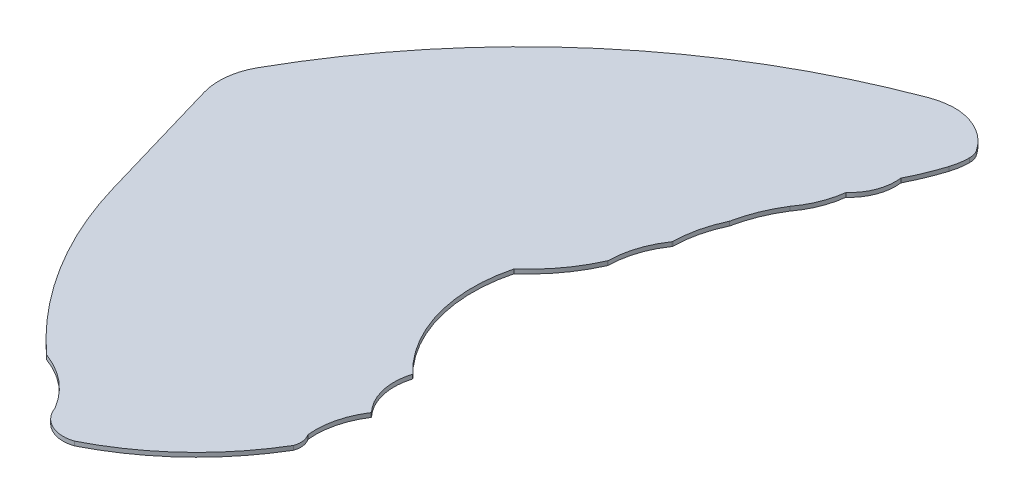
from build123d import *

# Parameters (mm, degrees)
RESSALTO_EXTRUS_O1_DEPTH = 2
RESSALTO_EXTRUS_O2_START = 2
RESSALTO_EXTRUS_O2_DEPTH = 0.2
ESBO_O3_W                = 13.5
ESBO_O3_H                = 41.75
CORTE_EXTRUS_O2_DEPTH    = 0.2


# Read off the part's stored shape, not the designer's step: Ressalto-extrusão2
with BuildPart() as part:
    # Esboço1 → Ressalto-extrusão1 (new body)
    with BuildSketch(Plane(origin=(0, 0, 0), x_dir=(1, 0, 0), z_dir=(0, 1, 0))):
        with BuildLine():
            Line((16.890636414, -92.871950666), (-2.891885916, -25.331386579))
            ThreePointArc((-2.891885916, -25.331386579), (-4.004170085, -12.373640544), (0, 0))
            ThreePointArc((0, 0), (80.341988523, 97.826401656), (189.397159866, 162.105555232))
            ThreePointArc((189.397159866, 162.105555232), (196.305976757, 163.870755082), (203.432149719, 164.126372503))
            ThreePointArc((203.432149719, 164.126372503), (216.132997815, 159.854580332), (225.805048795, 150.58035904))
            ThreePointArc((225.805048795, 150.58035904), (226.92415432, 148.202079294), (227.308114084, 145.601851107))
            ThreePointArc((227.308114084, 145.601851107), (226.936116515, 140.796582456), (225.828988219, 136.105819626))
            ThreePointArc((225.828988219, 136.105819626), (222.53357195, 127.064851642), (218.517613108, 118.320084919))
            ThreePointArc((218.517613108, 118.320084919), (217.157138995, 106.918422119), (210.665701384, 97.446883587))
            ThreePointArc((210.665701384, 97.446883587), (207.81407221, 86.384811826), (202.212176332, 76.428909901))
            ThreePointArc((202.212176332, 76.428909901), (196.683977717, 65.597702677), (193.192392505, 53.949318131))
            ThreePointArc((193.192392505, 53.949318131), (193.186037336, 53.925638832), (193.176832614, 53.902915046))
            ThreePointArc((193.176832614, 53.902915046), (189.041723719, 42.177149), (187.495240153, 29.840167866))
            ThreePointArc((187.495240153, 29.840167866), (187.463240561, 29.647364474), (187.376766076, 29.472095295))
            ThreePointArc((187.376766076, 29.472095295), (181.421355488, 17.384501121), (179.237322945, 4.087627428))
            ThreePointArc((179.237322945, 4.087627428), (179.232638679, 4.047550287), (179.220005433, 4.009229005))
            ThreePointArc((179.220005433, 4.009229005), (170.345122282, -11.218617872), (158.407910237, -24.186032419))
            ThreePointArc((158.407910237, -24.186032419), (158.838253644, -64.171647637), (179.513294894, -98.399958861))
            ThreePointArc((179.513294894, -98.399958861), (179.568845143, -98.494180052), (179.566523634, -98.60353303))
            ThreePointArc((179.566523634, -98.60353303), (179.033051629, -113.383903181), (185.969624565, -126.446364285))
            ThreePointArc((185.969624565, -126.446364285), (186.089619632, -126.716123165), (186.018022228, -127.002553753))
            ThreePointArc((186.018022228, -127.002553753), (180.544757753, -139.671656891), (179.579203123, -153.438664648))
            ThreePointArc((179.579203123, -153.438664648), (181.188239019, -157.584851871), (180.732122887, -162.008857192))
            ThreePointArc((180.732122887, -162.008857192), (155.03526296, -193.949101447), (121.431473842, -217.428734539))
            ThreePointArc((121.431473842, -217.428734539), (121.423131136, -217.432766567), (121.414649078, -217.436496537))
            ThreePointArc((121.414649078, -217.436496537), (109.339932134, -216.703217601), (101.317198447, -207.649365854))
            ThreePointArc((101.317198447, -207.649365854), (90.053250325, -194.317508541), (74.924632392, -185.614643143))
            ThreePointArc((74.924632392, -185.614643143), (39.509715195, -143.24681252), (16.890636414, -92.871950666))
        make_face()
        with BuildLine():
            Line((11.85931196, -37.464698075), (16.890636414, -86.132821))
            ThreePointArc((16.890636414, -86.132821), (23.057242833, -64.675979535), (40.261886529, -50.448424731))
            ThreePointArc((40.261886529, -50.448424731), (87.670250354, -46.538605901), (133.842737694, -57.981553802))
            ThreePointArc((133.842737694, -57.981553802), (149.854946418, -65.924493525), (163.541497745, -77.420555131))
            ThreePointArc((163.541497745, -77.420555131), (155.983137797, -51.598831019), (157.848232778, -24.758345519))
            ThreePointArc((157.848232778, -24.758345519), (151.973262614, -28.636570967), (145.058243072, -29.955059416))
            ThreePointArc((145.058243072, -29.955059416), (111.045550918, -28.261906009), (77.032122973, -29.940213308))
            ThreePointArc((77.032122973, -29.940213308), (57.801285112, -32.389959226), (39.361189646, -38.372371707))
            ThreePointArc((39.361189646, -38.372371707), (25.569939965, -39.139925167), (11.85931196, -37.464698075))
        make_face(mode=Mode.SUBTRACT)
        with BuildLine():
            ThreePointArc((11.070359275, -33.894012744), (10.253925603, -35.789100329), (11.879579324, -37.059994062))
            ThreePointArc((11.879579324, -37.059994062), (25.524465377, -38.738184329), (39.251467246, -37.984090401))
            ThreePointArc((39.251467246, -37.984090401), (45.854920305, -35.402452346), (52.618625636, -33.275779462))
            ThreePointArc((52.618625636, -33.275779462), (31.766860679, -28.367665282), (11.070359275, -33.894012744))
        make_face(mode=Mode.SUBTRACT)
        with BuildLine():
            ThreePointArc((202.714101827, 163.712950676), (167.471686306, 150.296359156), (134.231187047, 132.489001443))
            ThreePointArc((134.231187047, 132.489001443), (117.587042911, 117.093961509), (105.366397335, 97.997087152))
            ThreePointArc((105.366397335, 97.997087152), (119.960236596, 105.436275442), (134.832810466, 112.301274588))
            ThreePointArc((134.832810466, 112.301274588), (162.992204891, 129.355762587), (195.166849247, 136.327083543))
            ThreePointArc((195.166849247, 136.327083543), (210.329945011, 136.70097858), (225.494110918, 136.373346207))
            ThreePointArc((225.494110918, 136.373346207), (226.552562533, 140.93374904), (226.908114084, 145.601851107))
            ThreePointArc((226.908114084, 145.601851107), (226.541225779, 148.086469034), (225.471877456, 150.359006698))
            ThreePointArc((225.471877456, 150.359006698), (215.925826131, 159.51241094), (203.390434406, 163.728553659))
            ThreePointArc((203.390434406, 163.728553659), (203.051769924, 163.742347016), (202.714101827, 163.712950676))
        make_face(mode=Mode.SUBTRACT)
        with BuildLine():
            ThreePointArc((39.414410112, -134.60371344), (55.710509097, -160.996401051), (75.061191815, -185.238675693))
            ThreePointArc((75.061191815, -185.238675693), (90.32477142, -194.023121535), (101.682640282, -207.482028103))
            ThreePointArc((101.682640282, -207.482028103), (109.381253065, -216.277627559), (121.038273811, -217.140805352))
            ThreePointArc((121.038273811, -217.140805352), (94.455943613, -168.678582058), (73.078069491, -117.706100627))
            ThreePointArc((73.078069491, -117.706100627), (50.023709071, -102.94081443), (27.530070276, -87.334616156))
            ThreePointArc((27.530070276, -87.334616156), (27.068868432, -93.446906914), (27.564899418, -99.556469804))
            ThreePointArc((27.564899418, -99.556469804), (32.024240404, -117.575549791), (39.414410112, -134.60371344))
        make_face(mode=Mode.SUBTRACT)
        with BuildLine():
            ThreePointArc((55.949990062, -55.478367997), (95.05027781, -50.955008797), (133.708809753, -58.358466666))
            ThreePointArc((133.708809753, -58.358466666), (149.927402921, -66.450957854), (163.72457307, -78.205500545))
            ThreePointArc((163.72457307, -78.205500545), (163.984765643, -78.494020984), (164.23916715, -78.787660375))
            ThreePointArc((164.23916715, -78.787660375), (169.918511042, -87.993064481), (176.841349297, -96.30382391))
            ThreePointArc((176.841349297, -96.30382391), (128.956486326, -76.690746726), (77.454382768, -81.707341939))
            ThreePointArc((77.454382768, -81.707341939), (54.053212131, -80.755434548), (31.132626071, -75.942156085))
            ThreePointArc((31.132626071, -75.942156085), (41.348809985, -63.051320172), (55.949990062, -55.478367997))
        make_face(mode=Mode.SUBTRACT)
        with BuildLine():
            ThreePointArc((8.646375466, -29.892212669), (7.936541731, -32.891512454), (10.884162093, -33.792177396))
            ThreePointArc((10.884162093, -33.792177396), (83.286903321, -10.270827271), (158.195344978, -23.840507352))
            ThreePointArc((158.195344978, -23.840507352), (169.975242199, -11.046105684), (178.761046703, 3.962969299))
            ThreePointArc((178.761046703, 3.962969299), (124.842337918, 15.064533704), (69.841232126, 17.377594644))
            ThreePointArc((69.841232126, 17.377594644), (40.102456108, -7.368908744), (8.646375466, -29.892212669))
        make_face(mode=Mode.SUBTRACT)
        with BuildLine():
            ThreePointArc((65.873725431, 73.521849244), (65.512554625, 73.261919505), (65.163327011, 72.986151676))
            ThreePointArc((65.163327011, 72.986151676), (31.751463387, 24.609289931), (8.608266137, -29.43759531))
            ThreePointArc((8.608266137, -29.43759531), (68.727790014, 16.919047723), (121.642967981, 71.355060116))
            ThreePointArc((121.642967981, 71.355060116), (117.855262612, 78.759779692), (117.42803317, 87.066045938))
            ThreePointArc((117.42803317, 87.066045938), (110.028306452, 90.798172973), (104.841521177, 97.262071658))
            ThreePointArc((104.841521177, 97.262071658), (85.034977645, 85.921559119), (65.873725431, 73.521849244))
        make_face(mode=Mode.SUBTRACT)
        with BuildLine():
            ThreePointArc((104.7762631, 97.681029789), (115.574418721, 115.248461285), (130.105906511, 129.878932118))
            ThreePointArc((130.105906511, 129.878932118), (96.177838084, 104.381251589), (66.264337516, 74.274308482))
            ThreePointArc((66.264337516, 74.274308482), (85.206415837, 86.494114614), (104.7762631, 97.681029789))
        make_face(mode=Mode.SUBTRACT)
        with BuildLine():
            ThreePointArc((135.713472408, 112.526537053), (163.518917342, 129.134060421), (195.18595438, 135.927540062))
            ThreePointArc((195.18595438, 135.927540062), (210.276471462, 136.300892078), (225.368164637, 135.97856519))
            ThreePointArc((225.368164637, 135.97856519), (222.128079781, 127.130596632), (218.195023717, 118.568133932))
            ThreePointArc((218.195023717, 118.568133932), (176.701785201, 118.994028297), (135.713472408, 112.526537053))
        make_face(mode=Mode.SUBTRACT)
        with BuildLine():
            ThreePointArc((135.00518658, 111.940090583), (176.305917901, 118.563594016), (218.132560685, 118.172238852))
            ThreePointArc((218.132560685, 118.172238852), (216.767534509, 107.01891476), (210.409374715, 97.754264805))
            ThreePointArc((210.409374715, 97.754264805), (163.467402557, 97.622974649), (117.64681506, 87.422986968))
            ThreePointArc((117.64681506, 87.422986968), (110.323017386, 91.074314456), (105.194171334, 97.451237144))
            ThreePointArc((105.194171334, 97.451237144), (119.956691333, 104.989862866), (135.00518658, 111.940090583))
        make_face(mode=Mode.SUBTRACT)
        with BuildLine():
            ThreePointArc((121.975723187, 71.579960434), (118.238216137, 78.876060323), (117.832890254, 87.063718319))
            ThreePointArc((117.832890254, 87.063718319), (163.48468813, 97.222424933), (210.25288905, 97.368547957))
            ThreePointArc((210.25288905, 97.368547957), (207.439428108, 86.525283804), (201.957251989, 76.756062495))
            ThreePointArc((201.957251989, 76.756062495), (161.711502037, 78.108067884), (121.975723187, 71.579960434))
        make_face(mode=Mode.SUBTRACT)
        with BuildLine():
            ThreePointArc((201.712469543, 76.384918569), (196.290949467, 65.692265225), (192.837884131, 54.211757605))
            ThreePointArc((192.837884131, 54.211757605), (151.026567478, 57.488322955), (109.101297358, 56.395708613))
            ThreePointArc((109.101297358, 56.395708613), (115.62650859, 63.726667144), (122.015582584, 71.176571043))
            ThreePointArc((122.015582584, 71.176571043), (161.60786351, 77.700482874), (201.712469543, 76.384918569))
        make_face(mode=Mode.SUBTRACT)
        with BuildLine():
            ThreePointArc((187.097186474, 29.949540999), (139.348979985, 36.992165146), (91.086670247, 37.481283297))
            ThreePointArc((91.086670247, 37.481283297), (100.008574142, 46.616810225), (108.708987791, 55.963522143))
            ThreePointArc((108.708987791, 55.963522143), (150.759305033, 57.095075342), (192.697680535, 53.826703734))
            ThreePointArc((192.697680535, 53.826703734), (188.632596088, 42.184795574), (187.097186474, 29.949540999))
        make_face(mode=Mode.SUBTRACT)
        with BuildLine():
            ThreePointArc((70.307334653, 17.795498029), (125.114397795, 15.433974602), (178.842127699, 4.355978275))
            ThreePointArc((178.842127699, 4.355978275), (181.056540683, 17.556695855), (186.958653653, 29.570339432))
            ThreePointArc((186.958653653, 29.570339432), (139.066008112, 36.613044124), (90.660333167, 37.055558956))
            ThreePointArc((90.660333167, 37.055558956), (80.610470403, 27.291705844), (70.307334653, 17.795498029))
        make_face(mode=Mode.SUBTRACT)
        with BuildLine():
            ThreePointArc((53.184593307, -33.120484), (34.997673911, -28.037667048), (16.344111956, -30.977682642))
            ThreePointArc((16.344111956, -30.977682642), (86.294442644, -10.497166778), (157.8926845, -24.142387796))
            ThreePointArc((157.8926845, -24.142387796), (152.04587989, -28.173512381), (145.079823263, -29.555230382))
            ThreePointArc((145.079823263, -29.555230382), (111.043124536, -27.861905479), (77.00571445, -29.540870677))
            ThreePointArc((77.00571445, -29.540870677), (64.991382888, -30.640116345), (53.184593307, -33.120484))
        make_face(mode=Mode.SUBTRACT)
        with BuildLine():
            ThreePointArc((77.385630644, -82.110602151), (53.928434843, -81.142970387), (30.954862617, -76.306512457))
            ThreePointArc((30.954862617, -76.306512457), (28.904488661, -81.471516217), (27.604076284, -86.874314091))
            ThreePointArc((27.604076284, -86.874314091), (27.640126359, -86.915622588), (27.682018255, -86.950993041))
            ThreePointArc((27.682018255, -86.950993041), (50.20912985, -102.583681626), (73.29906303, -117.372417034))
            ThreePointArc((73.29906303, -117.372417034), (83.327149533, -118.337154453), (92.986045613, -121.200537717))
            ThreePointArc((92.986045613, -121.200537717), (96.035057019, -120.070400422), (99.274681475, -119.790196472))
            ThreePointArc((99.274681475, -119.790196472), (100.839320134, -116.575545142), (103.329588684, -114.010269354))
            ThreePointArc((103.329588684, -114.010269354), (99.325868559, -105.523547237), (98.476067628, -96.178384559))
            ThreePointArc((98.476067628, -96.178384559), (86.442113829, -91.376407189), (77.385630644, -82.110602151))
        make_face(mode=Mode.SUBTRACT)
        with BuildLine():
            ThreePointArc((77.796430253, -82.0108729), (130.390825581, -77.316445759), (178.842177575, -98.308695665))
            ThreePointArc((178.842177575, -98.308695665), (179.042636723, -98.592893915), (179.048514046, -98.940626531))
            ThreePointArc((179.048514046, -98.940626531), (178.557910182, -113.090704042), (184.838939896, -125.779835275))
            ThreePointArc((184.838939896, -125.779835275), (143.48611956, -105.890223927), (98.718726209, -95.813871314))
            ThreePointArc((98.718726209, -95.813871314), (86.794460768, -91.13013492), (77.796430253, -82.0108729))
        make_face(mode=Mode.SUBTRACT)
        with BuildLine():
            ThreePointArc((103.734386544, -113.889234988), (99.732427529, -105.493744387), (98.872883702, -96.233014243))
            ThreePointArc((98.872883702, -96.233014243), (143.098520561, -106.179072223), (183.998274189, -125.724945907))
            ThreePointArc((183.998274189, -125.724945907), (184.88113455, -126.943403006), (184.664770288, -128.432451905))
            ThreePointArc((184.664770288, -128.432451905), (179.978340813, -140.338043697), (179.145908385, -153.10569005))
            ThreePointArc((179.145908385, -153.10569005), (142.589295312, -131.287701646), (103.734386544, -113.889234988))
        make_face(mode=Mode.SUBTRACT)
        with BuildLine():
            ThreePointArc((99.649253017, -119.933520799), (101.18300434, -116.782199542), (103.6372122, -114.280183841))
            ThreePointArc((103.6372122, -114.280183841), (142.598272069, -131.743297777), (179.242488543, -153.655073914))
            ThreePointArc((179.242488543, -153.655073914), (180.78822356, -157.611813736), (180.367828424, -161.838911403))
            ThreePointArc((180.367828424, -161.838911403), (173.27117969, -172.652799603), (165.237327428, -182.789851396))
            ThreePointArc((165.237327428, -182.789851396), (133.00300151, -150.777649689), (99.649253017, -119.933520799))
        make_face(mode=Mode.SUBTRACT)
        with BuildLine():
            ThreePointArc((93.258837749, -121.508897014), (96.210985678, -120.441238679), (99.340524238, -120.194135217))
            ThreePointArc((99.340524238, -120.194135217), (132.717797326, -151.058354618), (164.973783051, -183.092614136))
            ThreePointArc((164.973783051, -183.092614136), (155.156655203, -193.286781209), (144.390735312, -202.473293628))
            ThreePointArc((144.390735312, -202.473293628), (116.188479484, -163.656017033), (93.258837749, -121.508897014))
        make_face(mode=Mode.SUBTRACT)
        with BuildLine():
            ThreePointArc((121.414649077, -216.988884436), (133.074913856, -210.37840662), (144.073565841, -202.71747677))
            ThreePointArc((144.073565841, -202.71747677), (115.816888065, -163.816723913), (92.849554804, -121.576813702))
            ThreePointArc((92.849554804, -121.576813702), (83.369797481, -118.753083082), (73.527113878, -117.772862193))
            ThreePointArc((73.527113878, -117.772862193), (94.877808499, -168.632444086), (121.414649077, -216.988884436))
        make_face(mode=Mode.SUBTRACT)
    extrude(amount=RESSALTO_EXTRUS_O1_DEPTH)

    # Ressalto-extrusão2 outline → Ressalto-extrusão2 (add)
    with BuildSketch(Plane(origin=(0, 0, 0), x_dir=(1, 0, 0), z_dir=(0, 1, 0)).offset(RESSALTO_EXTRUS_O2_START)):
        with BuildLine():
            ThreePointArc((16.890636414, -92.871950666), (39.509715195, -143.24681252), (74.924632392, -185.614643143))
            ThreePointArc((74.924632392, -185.614643143), (90.053250325, -194.317508541), (101.317198447, -207.649365854))
            ThreePointArc((101.317198447, -207.649365854), (109.339932134, -216.703217601), (121.414649078, -217.436496537))
            ThreePointArc((121.414649078, -217.436496537), (121.423131136, -217.432766567), (121.431473842, -217.428734539))
            ThreePointArc((121.431473842, -217.428734539), (155.03526296, -193.949101447), (180.732122887, -162.008857192))
            ThreePointArc((180.732122887, -162.008857192), (181.188239019, -157.584851871), (179.579203123, -153.438664648))
            ThreePointArc((179.579203123, -153.438664648), (180.544757753, -139.671656891), (186.018022228, -127.002553753))
            ThreePointArc((186.018022228, -127.002553753), (186.089619632, -126.716123165), (185.969624565, -126.446364285))
            ThreePointArc((185.969624565, -126.446364285), (179.033051629, -113.383903181), (179.566523634, -98.60353303))
            ThreePointArc((179.566523634, -98.60353303), (179.568845143, -98.494180052), (179.513294894, -98.399958861))
            ThreePointArc((179.513294894, -98.399958861), (158.838253644, -64.171647638), (158.407910237, -24.186032419))
            ThreePointArc((158.407910237, -24.186032419), (170.345122282, -11.218617872), (179.220005433, 4.009229005))
            ThreePointArc((179.220005433, 4.009229005), (179.232638679, 4.047550287), (179.237322945, 4.087627428))
            ThreePointArc((179.237322945, 4.087627428), (181.421355488, 17.384501122), (187.376766076, 29.472095295))
            ThreePointArc((187.376766076, 29.472095295), (187.463240561, 29.647364474), (187.495240153, 29.840167866))
            ThreePointArc((187.495240153, 29.840167866), (189.041723719, 42.177149), (193.176832614, 53.902915046))
            ThreePointArc((193.176832614, 53.902915046), (193.186037336, 53.925638832), (193.192392505, 53.949318131))
            ThreePointArc((193.192392505, 53.949318131), (196.683977717, 65.597702678), (202.212176332, 76.428909901))
            ThreePointArc((202.212176332, 76.428909901), (207.81407221, 86.384811826), (210.665701384, 97.446883587))
            ThreePointArc((210.665701384, 97.446883587), (217.157138995, 106.918422119), (218.517613108, 118.320084919))
            ThreePointArc((218.517613108, 118.320084919), (222.53357195, 127.064851642), (225.828988219, 136.105819626))
            ThreePointArc((225.828988219, 136.105819626), (226.936116515, 140.796582456), (227.308114084, 145.601851107))
            ThreePointArc((227.308114084, 145.601851107), (226.92415432, 148.202079294), (225.805048795, 150.58035904))
            ThreePointArc((225.805048795, 150.58035904), (216.132997815, 159.854580332), (203.432149719, 164.126372503))
            ThreePointArc((203.432149719, 164.126372503), (196.305976757, 163.870755082), (189.397159866, 162.105555232))
            ThreePointArc((189.397159866, 162.105555232), (80.341988523, 97.826401656), (0, 0))
            ThreePointArc((0, 0), (-4.004170085, -12.373640544), (-2.891885916, -25.331386579))
            Line((-2.891885916, -25.331386579), (16.890636414, -92.871950666))
        make_face()
    extrude(amount=RESSALTO_EXTRUS_O2_DEPTH)

    # Esboço3 → Corte-extrusão2 (cut)
    with BuildSketch(Plane(origin=(0, 0, 0), x_dir=(1, 0, 0), z_dir=(0, 1, 0))):
        with Locations((1.25, -9.755)):
            Rectangle(ESBO_O3_W, ESBO_O3_H)
    extrude(amount=CORTE_EXTRUS_O2_DEPTH, mode=Mode.SUBTRACT)


solid = part.part
